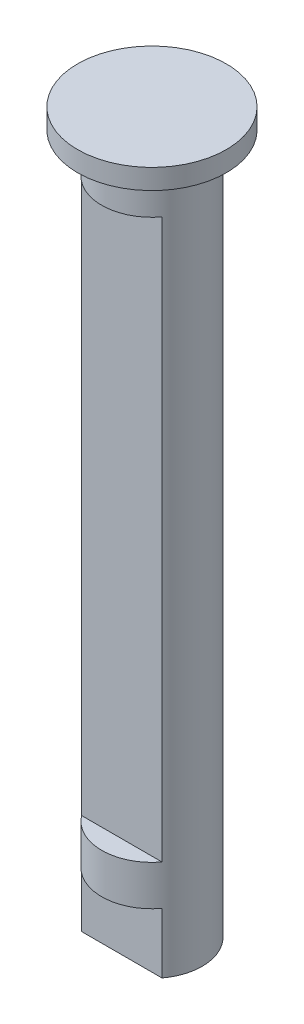
from build123d import *
from build123d.topology import SkipClean

# Parameters (mm, degrees)
EXTRUDE_1_DEPTH = 27.8
SKETCH_2_R      = 2.5
EXTRUDE_2_DEPTH = 2
SKETCH_3_R      = 3.7
EXTRUDE_3_DEPTH = 1
EXTRUDE_START   = 2
SKETCH_4_R      = 2.5
EXTRUDE_4_DEPTH = 2
EXTRUDE_START_2 = 3
EXTRUDE_5_DEPTH = 3


with BuildPart() as part:
    # 草图1 → 凸台-拉伸1 (new body)
    with BuildSketch(Plane(origin=(0, 0, 0), x_dir=(1, 0, 0), z_dir=(0, 1, 0))):
        with BuildLine():
            Line((-2, -1.5), (2, -1.5))
            ThreePointArc((2, -1.5), (0, 2.5), (-2, -1.5))
        make_face()
    extrude(amount=EXTRUDE_1_DEPTH)

    # 草图2 → 凸台-拉伸2 (add)
    with BuildSketch(Plane(origin=(0, 27.8, 0), x_dir=(1, 0, 0), z_dir=(0, 1, 0))):
        Circle(SKETCH_2_R)
    extrude(amount=EXTRUDE_2_DEPTH)

    # 草图3 → 凸台-拉伸3 (add)
    with BuildSketch(Plane(origin=(0, 29.8, 0), x_dir=(1, 0, 0), z_dir=(0, 1, 0))):
        Circle(SKETCH_3_R)
    extrude(amount=EXTRUDE_3_DEPTH)

    # 草图4 → 凸台-拉伸4 (add)
    with BuildSketch(Plane.XZ.offset(EXTRUDE_START)):
        Circle(SKETCH_4_R)
    extrude(amount=-EXTRUDE_4_DEPTH)

    # 草图5 → 凸台-拉伸5 (add)
    with SkipClean():  # the faces are left unmerged after this step: merging them gives an invalid solid
        with BuildSketch(Plane.XZ.offset(2).offset(EXTRUDE_START_2)):
            with BuildLine():
                Line((-2, 1.5), (2, 1.5))
                ThreePointArc((2, 1.5), (0, -2.5), (-2, 1.5))
            make_face()
        extrude(amount=-EXTRUDE_5_DEPTH)
    add(part.part.scale(1), mode=Mode.REPLACE)  # the faces are merged on a copy


solid = part.part
